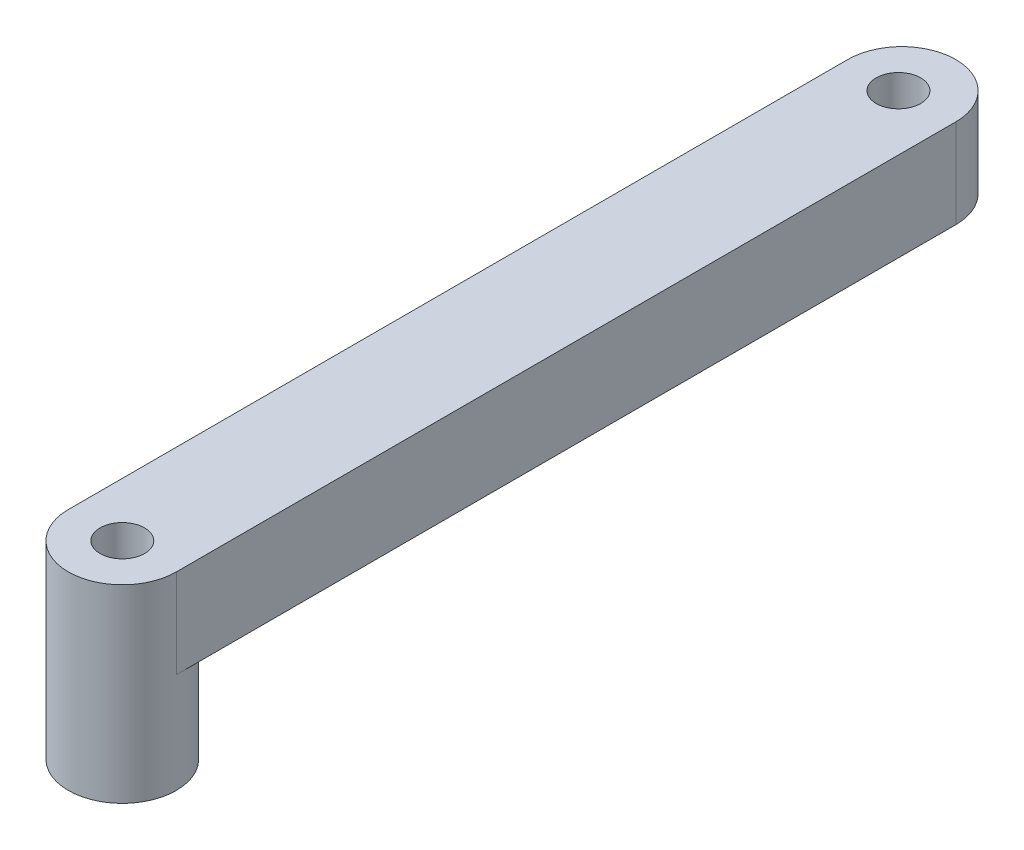
from build123d import *

# Parameters (mm, degrees)
SKETCH1_R           = 4.85
SKETCH1_R_2         = 2
BOSS_EXTRUDE1_DEPTH = 9
BOSS_EXTRUDE2_DEPTH = 8
SKETCH4_R           = 2
CUT_EXTRUDE1_DEPTH  = 10
SKETCH5_R           = 2
CUT_EXTRUDE2_DEPTH  = 10


with BuildPart() as part:
    # Sketch1 → Boss-Extrude1 (new body)
    with BuildSketch(Plane(origin=(0, 0, 0), x_dir=(1, 0, 0), z_dir=(0, 1, 0))):
        Circle(SKETCH1_R)
        Circle(SKETCH1_R_2, mode=Mode.SUBTRACT)
    extrude(amount=BOSS_EXTRUDE1_DEPTH)

    # Sketch2 → Boss-Extrude2 (add)
    with BuildSketch(Plane(origin=(0, 9, 0), x_dir=(1, 0, 0), z_dir=(0, 1, 0))):
        with BuildLine():
            Line((-4.85, 0), (-4.85, 70))
            ThreePointArc((-4.85, 70), (0, 74.85), (4.85, 70))
            Line((4.85, 70), (4.85, 0))
            ThreePointArc((4.85, 0), (0, -4.85), (-4.85, 0))
        make_face()
    extrude(amount=BOSS_EXTRUDE2_DEPTH)

    # Sketch4 → Cut-Extrude1 (cut)
    with BuildSketch(Plane.XZ.offset(-9)):
        Circle(SKETCH4_R)
    extrude(amount=-CUT_EXTRUDE1_DEPTH, mode=Mode.SUBTRACT)

    # Sketch5 → Cut-Extrude2 (cut)
    with BuildSketch(Plane(origin=(0, 17, 0), x_dir=(1, 0, 0), z_dir=(0, 1, 0))):
        with Locations((-0.15, 69.852250506)):
            Circle(SKETCH5_R)
    extrude(amount=-CUT_EXTRUDE2_DEPTH, mode=Mode.SUBTRACT)


solid = part.part
